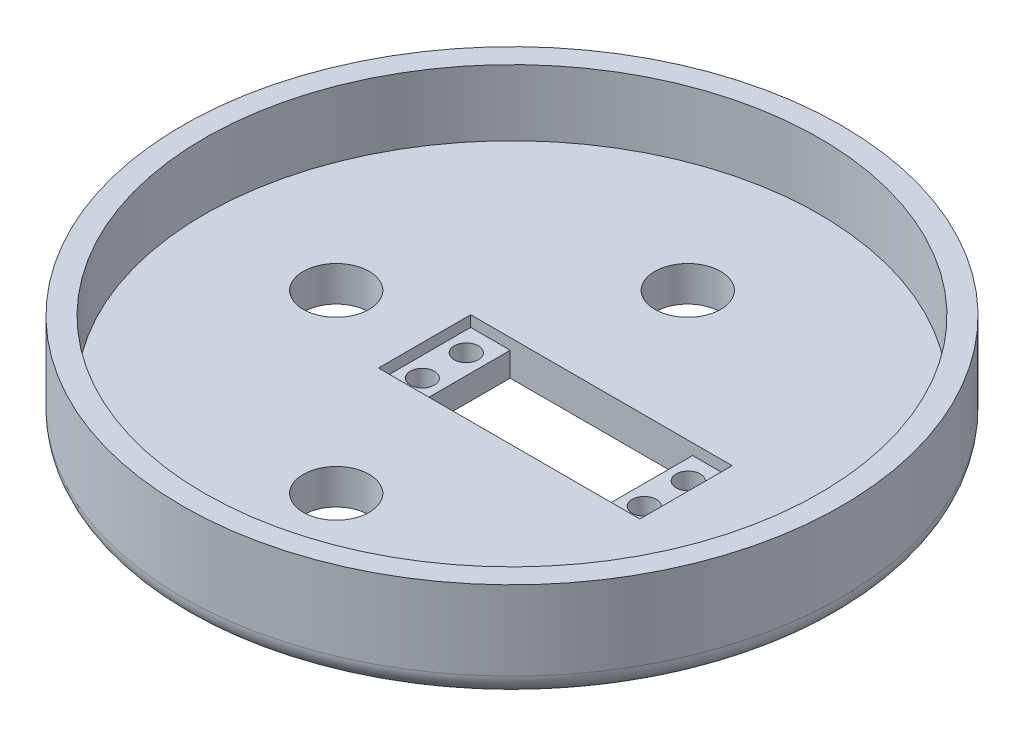
from build123d import *

# Parameters (mm, degrees)
SKETCH1_R               = 75
BOSS_EXTRUDE1_DEPTH     = 8
SKETCH5_R               = 75
SKETCH5_R_2             = 70
BOSS_EXTRUDE2_DEPTH     = 15
CUT_EXTRUDE6_DEPTH      = 108.121426428
CUT_EXTRUDE6_DEPTH_BACK = 108.121426428
SKETCH2_W               = 41.5
SKETCH2_H               = 21
SKETCH8_W               = 9
SKETCH8_H               = 21
SKETCH8_R               = 2.75
CUT_EXTRUDE7_DEPTH      = 2.5
CUT_EXTRUDE8_DEPTH      = 108.121426428
CUT_EXTRUDE8_DEPTH_BACK = 108.121426428
SKETCH9_R               = 2.75
FILLET2_R               = 5
SKETCH11_R              = 7.5
CUT_EXTRUDE9_DEPTH      = 10


with BuildPart() as part:
    # Sketch1 → Boss-Extrude1 (new body)
    with BuildSketch(Plane(origin=(0, 0, 0), x_dir=(1, 0, 0), z_dir=(0, 1, 0))):
        Circle(SKETCH1_R)
    extrude(amount=BOSS_EXTRUDE1_DEPTH)

    # Sketch5 → Boss-Extrude2 (add)
    with BuildSketch(Plane(origin=(0, 8, 0), x_dir=(1, 0, 0), z_dir=(0, 1, 0))):
        Circle(SKETCH5_R)
        Circle(SKETCH5_R_2, mode=Mode.SUBTRACT)
    extrude(amount=BOSS_EXTRUDE2_DEPTH)

    # Sketch2 → Cut-Extrude6 (cut, two sides: drawn at the far end of the back side and taken through both)
    with BuildSketch(Plane(origin=(0, 8, 0), x_dir=(1, 0, 0), z_dir=(0, 1, 0)).offset(-CUT_EXTRUDE6_DEPTH_BACK)):
        with Locations((9.85, 0)):
            Rectangle(SKETCH2_W, SKETCH2_H)
    extrude(amount=CUT_EXTRUDE6_DEPTH + CUT_EXTRUDE6_DEPTH_BACK, mode=Mode.SUBTRACT)

    # Sketch8 → Cut-Extrude7 (cut)
    # profile 1 of 2: a face of its own
    with BuildSketch(Plane(origin=(0, 8, 0), x_dir=(1, 0, 0), z_dir=(0, 1, 0))):
        with Locations((-15.4, 0)):
            Rectangle(SKETCH8_W, SKETCH8_H)
        with Locations((-15.4, 5)):
            Circle(SKETCH8_R, mode=Mode.SUBTRACT)
        with Locations((-15.4, -5)):
            Circle(SKETCH8_R, mode=Mode.SUBTRACT)
    # profile 2 of 2: a face of its own
    with BuildSketch(Plane(origin=(0, 8, 0), x_dir=(1, 0, 0), z_dir=(0, 1, 0))):
        with Locations((35.1, 0)):
            Rectangle(SKETCH8_W, SKETCH8_H)
        with Locations((35.1, -5)):
            Circle(SKETCH8_R, mode=Mode.SUBTRACT)
        with Locations((35.1, 5)):
            Circle(SKETCH8_R, mode=Mode.SUBTRACT)
    extrude(amount=-CUT_EXTRUDE7_DEPTH, mode=Mode.SUBTRACT)

    # Sketch9 → Cut-Extrude8 (cut, two sides: drawn at the far end of the back side and taken through both)
    with BuildSketch(Plane(origin=(0, 8, 0), x_dir=(1, 0, 0), z_dir=(0, 1, 0)).offset(-CUT_EXTRUDE8_DEPTH_BACK)):
        with Locations((-15.4, 5)):
            Circle(SKETCH9_R)
        with Locations((-15.4, -5)):
            Circle(SKETCH9_R)
        with Locations((35.1, 5)):
            Circle(SKETCH9_R)
        with Locations((35.1, -5)):
            Circle(SKETCH9_R)
    extrude(amount=CUT_EXTRUDE8_DEPTH + CUT_EXTRUDE8_DEPTH_BACK, mode=Mode.SUBTRACT)

    # Fillet2
    fillet2_edges = [part.edges().sort_by_distance(p)[0] for p in [
        (-75, 0, 0),
    ]]
    fillet(fillet2_edges, radius=FILLET2_R)

    # Sketch11 → Cut-Extrude9 (cut)
    with BuildSketch(Plane.XZ):
        with Locations((0, 40)):
            Circle(SKETCH11_R)
        with Locations((0, -40)):
            Circle(SKETCH11_R)
        with Locations((-40, 0)):
            Circle(SKETCH11_R)
    extrude(amount=-CUT_EXTRUDE9_DEPTH, mode=Mode.SUBTRACT)


solid = part.part
